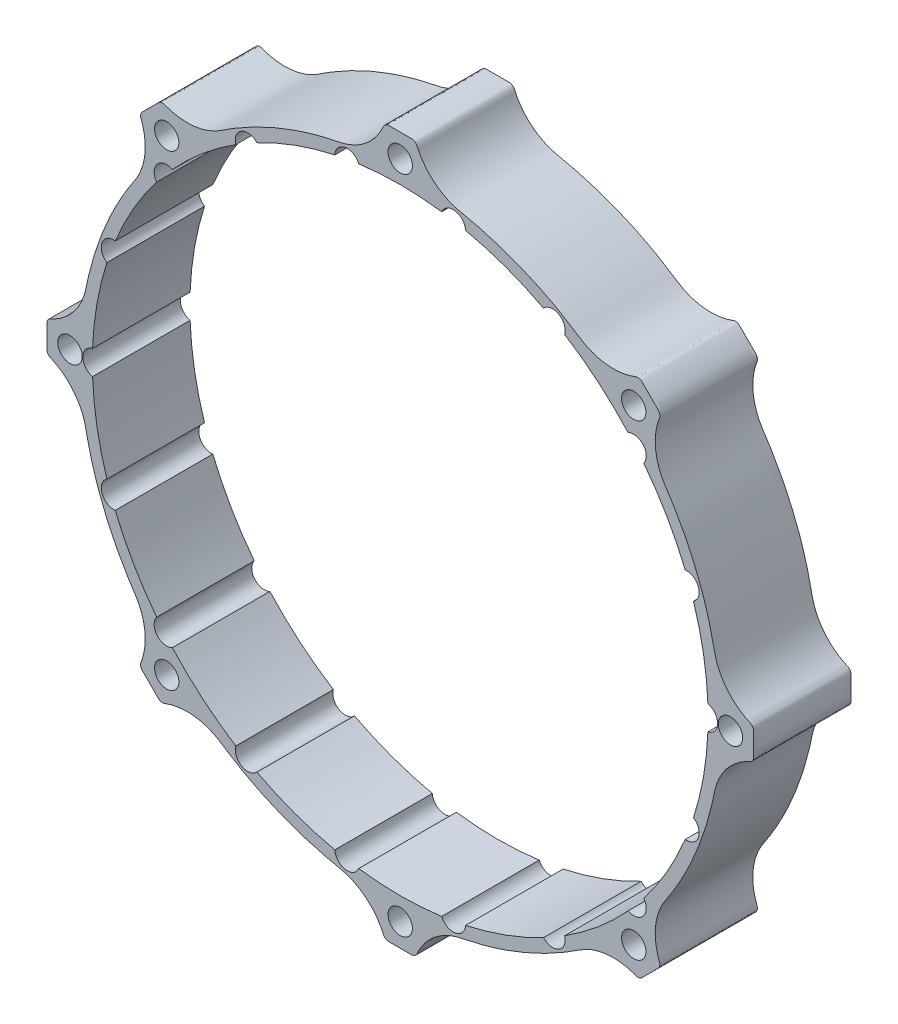
from build123d import *

# Parameters (mm, degrees)
BOSS_EXTRUDE1_DEPTH             = 16
F_4_0MM_DOWEL_HOLE1_D           = 4
F_4_0MM_DOWEL_HOLE1_CSINK_D     = 4.05
F_4_0MM_DOWEL_HOLE1_CSINK_ANGLE = 90
CIRPATTERN1_COUNT               = 8


with BuildPart() as part:
    # Sketch1 → Boss-Extrude1 (new body)
    with BuildSketch(Plane.XY):
        with BuildLine():
            add(Edge.make_bspline(
                [(2.895249818, 57.070593275), (2.866328079, 57.131672052), (2.809722916, 57.254415967), (2.730314338, 57.444073844), (2.653418588, 57.556069844), (2.609742987, 57.607640434), (2.483296792, 57.756943586), (2.319504695, 57.863958634), (2.131986062, 57.91978724), (2.101278346, 57.928929633), (2.038984153, 57.944262814), (1.942760285, 57.961362401), (1.878680735, 57.961362401), (1.84664096, 57.961362401), (1.814601185, 57.961362401), (1.750521635, 57.961362401), (1.654402311, 57.961362401), (1.590322761, 57.961362401), (1.558282986, 57.961362401), (0.519427662, 57.961362401), (-0.519427662, 57.961362401), (-1.558282986, 57.961362401), (-1.590322761, 57.961362401), (-1.654402311, 57.961362401), (-1.750521635, 57.961362401), (-1.814601185, 57.961362401), (-1.84664096, 57.961362401), (-1.878680735, 57.961362401), (-1.942760285, 57.961362401), (-2.038984153, 57.944262814), (-2.101278346, 57.928929633), (-2.131986062, 57.91978724), (-2.319504695, 57.863958634), (-2.483296792, 57.756943586), (-2.609742987, 57.607640434), (-2.653418588, 57.556069844), (-2.730314338, 57.444073844), (-2.809722916, 57.254415967), (-2.866328079, 57.131672052), (-2.895249818, 57.070593275), (-3.907352197, 54.933170755), (-5.586945631, 53.268270712), (-7.733178428, 52.274987752), (-8.218210626, 52.050513399), (-9.224266632, 51.679333443), (-10.81473369, 51.382377685), (-11.857368808, 51.146245707), (-12.376762361, 51.020248465), (-17.660128133, 49.738581586), (-22.682891966, 47.658084686), (-27.325071073, 44.828456262), (-27.781431281, 44.550283063), (-28.685656165, 43.979999224), (-30.020265638, 43.065348612), (-30.994118526, 42.616423452), (-31.495815419, 42.432181232), (-33.809504892, 41.582506281), (-36.274163076, 41.606308243), (-38.571011409, 42.500508575), (-38.571845248, 42.500833202), (-38.573512838, 42.50148268), (-38.57601405, 42.502457345), (-38.577681205, 42.503107942), (-38.578514782, 42.50343324), (-38.579346338, 42.50375775), (-38.581009449, 42.504406769), (-38.583504116, 42.505380297), (-38.585167228, 42.506029317), (-38.585998784, 42.506353826), (-38.590988118, 42.508300883), (-38.595977452, 42.510247941), (-38.600966787, 42.512194998), (-38.601798343, 42.512519508), (-38.603461454, 42.513168527), (-38.605956121, 42.514142055), (-38.607619233, 42.514791074), (-38.608450788, 42.515115584), (-38.60928525, 42.515441228), (-38.610954174, 42.516092515), (-38.613462374, 42.517057113), (-38.615135637, 42.517697174), (-38.615972697, 42.51801608), (-38.892469699, 42.623356827), (-39.187709119, 42.603838871), (-39.447932521, 42.463016124), (-39.476110803, 42.447767138), (-39.531001645, 42.414560688), (-39.611133429, 42.358611372), (-39.656444513, 42.313300288), (-39.679100055, 42.290644746), (-39.701755597, 42.267989204), (-39.747066681, 42.22267812), (-39.815033308, 42.154711493), (-39.860344392, 42.109400409), (-39.882999934, 42.086744867), (-40.617581578, 41.352163223), (-41.352163223, 40.617581578), (-42.086744867, 39.882999934), (-42.109400409, 39.860344392), (-42.154711493, 39.815033308), (-42.22267812, 39.747066681), (-42.267989204, 39.701755597), (-42.290644746, 39.679100055), (-42.313300288, 39.656444513), (-42.358611372, 39.611133429), (-42.414560688, 39.531001645), (-42.447767138, 39.476110803), (-42.463016124, 39.447932521), (-42.603838871, 39.187709119), (-42.623356827, 38.892469699), (-42.51801608, 38.615972697), (-42.517697174, 38.615135637), (-42.517057113, 38.613462374), (-42.516092515, 38.610954174), (-42.515441228, 38.60928525), (-42.515115584, 38.608450788), (-42.514791074, 38.607619233), (-42.514142055, 38.605956121), (-42.513168527, 38.603461454), (-42.512519508, 38.601798343), (-42.512194998, 38.600966787), (-42.510247941, 38.595977452), (-42.508300883, 38.590988118), (-42.506353826, 38.585998784), (-42.506029317, 38.585167228), (-42.505380297, 38.583504116), (-42.504406769, 38.581009449), (-42.50375775, 38.579346338), (-42.50343324, 38.578514782), (-42.503107942, 38.577681205), (-42.502457345, 38.57601405), (-42.50148268, 38.573512838), (-42.500833202, 38.571845248), (-42.500508575, 38.571011409), (-41.606308243, 36.274163076), (-41.582506281, 33.809504892), (-42.432181232, 31.495815419), (-42.616423452, 30.994118526), (-43.065348612, 30.020265638), (-43.979999224, 28.685656165), (-44.550283063, 27.781431281), (-44.828456262, 27.325071073), (-47.658084686, 22.682891966), (-49.738581586, 17.660128133), (-51.020248465, 12.376762361), (-51.146245707, 11.857368808), (-51.382377685, 10.81473369), (-51.679333443, 9.224266632), (-52.050513399, 8.218210626), (-52.274987752, 7.733178428), (-53.310202347, 5.496341992), (-55.069809391, 3.770396005), (-57.326221542, 2.778574093), (-57.327040701, 2.778214026), (-57.328679116, 2.777494111), (-57.331136932, 2.776414679), (-57.332775829, 2.775695865), (-57.333595278, 2.775336457), (-57.33441274, 2.774977922), (-57.336047663, 2.77426085), (-57.338500048, 2.773185243), (-57.340134971, 2.772468171), (-57.340952433, 2.772109635), (-57.345857202, 2.76995842), (-57.350761972, 2.767807206), (-57.355666742, 2.765655991), (-57.356484203, 2.765297455), (-57.358119126, 2.764580384), (-57.360571511, 2.763504776), (-57.362206434, 2.762787705), (-57.363023896, 2.762429169), (-57.363844214, 2.76206938), (-57.365484851, 2.761349803), (-57.367940491, 2.760258311), (-57.369576258, 2.759527727), (-57.370393649, 2.759161337), (-57.640393711, 2.638135588), (-57.835358227, 2.415568513), (-57.91978724, 2.131986062), (-57.928929633, 2.101278346), (-57.944262814, 2.038984153), (-57.961362401, 1.942760285), (-57.961362401, 1.878680735), (-57.961362401, 1.84664096), (-57.961362401, 1.814601185), (-57.961362401, 1.750521635), (-57.961362401, 1.654402311), (-57.961362401, 1.590322761), (-57.961362401, 1.558282986), (-57.961362401, 0.519427662), (-57.961362401, -0.519427662), (-57.961362401, -1.558282986), (-57.961362401, -1.590322761), (-57.961362401, -1.654402311), (-57.961362401, -1.750521635), (-57.961362401, -1.814601185), (-57.961362401, -1.84664096), (-57.961362401, -1.878680735), (-57.961362401, -1.942760285), (-57.944262814, -2.038984153), (-57.928929633, -2.101278346), (-57.91978724, -2.131986062), (-57.835358227, -2.415568513), (-57.640393711, -2.638135588), (-57.370393649, -2.759161337), (-57.369576258, -2.759527727), (-57.367940491, -2.760258311), (-57.365484851, -2.761349803), (-57.363844214, -2.76206938), (-57.363023896, -2.762429169), (-57.362206434, -2.762787705), (-57.360571511, -2.763504776), (-57.358119126, -2.764580384), (-57.356484203, -2.765297455), (-57.355666742, -2.765655991), (-57.350761972, -2.767807206), (-57.345857202, -2.76995842), (-57.340952433, -2.772109635), (-57.340134971, -2.772468171), (-57.338500048, -2.773185243), (-57.336047663, -2.77426085), (-57.33441274, -2.774977922), (-57.333595278, -2.775336457), (-57.332775829, -2.775695865), (-57.331136932, -2.776414679), (-57.328679116, -2.777494111), (-57.327040701, -2.778214026), (-57.326221542, -2.778574093), (-55.069809391, -3.770396005), (-53.310202347, -5.496341992), (-52.274987752, -7.733178428), (-52.050513399, -8.218210626), (-51.679333443, -9.224266632), (-51.382377685, -10.81473369), (-51.146245707, -11.857368808), (-51.020248465, -12.376762361), (-49.738581586, -17.660128133), (-47.658084686, -22.682891966), (-44.828456262, -27.325071073), (-44.550283063, -27.781431281), (-43.979999224, -28.685656165), (-43.065348612, -30.020265638), (-42.616423452, -30.994118526), (-42.432181232, -31.495815419), (-41.582506281, -33.809504892), (-41.606308243, -36.274163076), (-42.500508575, -38.571011409), (-42.500833202, -38.571845248), (-42.50148268, -38.573512838), (-42.502457345, -38.57601405), (-42.503107942, -38.577681205), (-42.50343324, -38.578514782), (-42.50375775, -38.579346338), (-42.504406769, -38.581009449), (-42.505380297, -38.583504116), (-42.506029317, -38.585167228), (-42.506353826, -38.585998784), (-42.508300883, -38.590988118), (-42.510247941, -38.595977452), (-42.512194998, -38.600966787), (-42.512519508, -38.601798343), (-42.513168527, -38.603461454), (-42.514142055, -38.605956121), (-42.514791074, -38.607619233), (-42.515115584, -38.608450788), (-42.515441228, -38.60928525), (-42.516092515, -38.610954174), (-42.517057113, -38.613462374), (-42.517697174, -38.615135637), (-42.51801608, -38.615972697), (-42.623356827, -38.892469699), (-42.603838871, -39.187709119), (-42.463016124, -39.447932521), (-42.447767138, -39.476110803), (-42.414560688, -39.531001645), (-42.358611372, -39.611133429), (-42.313300288, -39.656444513), (-42.290644746, -39.679100055), (-42.267989204, -39.701755597), (-42.22267812, -39.747066681), (-42.154711493, -39.815033308), (-42.109400409, -39.860344392), (-42.086744867, -39.882999934), (-41.352163223, -40.617581578), (-40.617581578, -41.352163223), (-39.882999934, -42.086744867), (-39.860344392, -42.109400409), (-39.815033308, -42.154711493), (-39.747066681, -42.22267812), (-39.701755597, -42.267989204), (-39.679100055, -42.290644746), (-39.656444513, -42.313300288), (-39.611133429, -42.358611372), (-39.531001645, -42.414560688), (-39.476110803, -42.447767138), (-39.447932521, -42.463016124), (-39.187709119, -42.603838871), (-38.892469699, -42.623356827), (-38.615972697, -42.51801608), (-38.615135637, -42.517697174), (-38.613462374, -42.517057113), (-38.610954174, -42.516092515), (-38.60928525, -42.515441228), (-38.608450788, -42.515115584), (-38.607619233, -42.514791074), (-38.605956121, -42.514142055), (-38.603461454, -42.513168527), (-38.601798343, -42.512519508), (-38.600966787, -42.512194998), (-38.595977452, -42.510247941), (-38.590988118, -42.508300883), (-38.585998784, -42.506353826), (-38.585167228, -42.506029317), (-38.583504116, -42.505380297), (-38.581009449, -42.504406769), (-38.579346338, -42.50375775), (-38.578514782, -42.50343324), (-38.577681205, -42.503107942), (-38.57601405, -42.502457345), (-38.573512838, -42.50148268), (-38.571845248, -42.500833202), (-38.571011409, -42.500508575), (-36.274163076, -41.606308243), (-33.809504892, -41.582506281), (-31.495815419, -42.432181232), (-30.994118526, -42.616423452), (-30.020265638, -43.065348612), (-28.685656165, -43.979999224), (-27.781431281, -44.550283063), (-27.325071073, -44.828456262), (-22.682891966, -47.658084686), (-17.660128133, -49.738581586), (-12.376762361, -51.020248465), (-11.857368808, -51.146245707), (-10.81473369, -51.382377685), (-9.224266632, -51.679333443), (-8.218210626, -52.050513399), (-7.733178428, -52.274987752), (-5.496341992, -53.310202347), (-3.770396005, -55.069809391), (-2.778574093, -57.326221542), (-2.778214026, -57.327040701), (-2.777494111, -57.328679116), (-2.776414679, -57.331136932), (-2.775695865, -57.332775829), (-2.775336457, -57.333595278), (-2.774977922, -57.33441274), (-2.77426085, -57.336047663), (-2.773185243, -57.338500048), (-2.772468171, -57.340134971), (-2.772109635, -57.340952433), (-2.76995842, -57.345857202), (-2.767807206, -57.350761972), (-2.765655991, -57.355666742), (-2.765297455, -57.356484203), (-2.764580384, -57.358119126), (-2.763504776, -57.360571511), (-2.762787705, -57.362206434), (-2.762429169, -57.363023896), (-2.76206938, -57.363844214), (-2.761349803, -57.365484851), (-2.760258311, -57.367940491), (-2.759527727, -57.369576258), (-2.759161337, -57.370393649), (-2.638135588, -57.640393711), (-2.415568513, -57.835358227), (-2.131986062, -57.91978724), (-2.101278346, -57.928929633), (-2.038984153, -57.944262814), (-1.942760285, -57.961362401), (-1.878680735, -57.961362401), (-1.84664096, -57.961362401), (-1.814601185, -57.961362401), (-1.750521635, -57.961362401), (-1.654402311, -57.961362401), (-1.590322761, -57.961362401), (-1.558282986, -57.961362401), (-0.519427662, -57.961362401), (0.519427662, -57.961362401), (1.558282986, -57.961362401), (1.590322761, -57.961362401), (1.654402311, -57.961362401), (1.750521635, -57.961362401), (1.814601185, -57.961362401), (1.84664096, -57.961362401), (1.878680735, -57.961362401), (1.942760285, -57.961362401), (2.038984153, -57.944262814), (2.101278346, -57.928929633), (2.131986062, -57.91978724), (2.415568513, -57.835358227), (2.638135588, -57.640393711), (2.759161337, -57.370393649), (2.759527727, -57.369576258), (2.760258311, -57.367940491), (2.761349803, -57.365484851), (2.76206938, -57.363844214), (2.762429169, -57.363023896), (2.762787705, -57.362206434), (2.763504776, -57.360571511), (2.764580384, -57.358119126), (2.765297455, -57.356484203), (2.765655991, -57.355666742), (2.767807206, -57.350761972), (2.76995842, -57.345857202), (2.772109635, -57.340952433), (2.772468171, -57.340134971), (2.773185243, -57.338500048), (2.77426085, -57.336047663), (2.774977922, -57.33441274), (2.775336457, -57.333595278), (2.775695865, -57.332775829), (2.776414679, -57.331136932), (2.777494111, -57.328679116), (2.778214026, -57.327040701), (2.778574093, -57.326221542), (3.770396005, -55.069809391), (5.496341992, -53.310202347), (7.733178428, -52.274987752), (8.218210626, -52.050513399), (9.224266632, -51.679333443), (10.81473369, -51.382377685), (11.857368808, -51.146245707), (12.376762361, -51.020248465), (17.660128133, -49.738581586), (22.682891966, -47.658084686), (27.325071073, -44.828456262), (27.781431281, -44.550283063), (28.685656165, -43.979999224), (30.020265638, -43.065348612), (30.994118526, -42.616423452), (31.495815419, -42.432181232), (33.809504892, -41.582506281), (36.274163076, -41.606308243), (38.571011409, -42.500508575), (38.571845248, -42.500833202), (38.573512838, -42.50148268), (38.57601405, -42.502457345), (38.577681205, -42.503107942), (38.578514782, -42.50343324), (38.579346338, -42.50375775), (38.581009449, -42.504406769), (38.583504116, -42.505380297), (38.585167228, -42.506029317), (38.585998784, -42.506353826), (38.590988118, -42.508300883), (38.595977452, -42.510247941), (38.600966787, -42.512194998), (38.601798343, -42.512519508), (38.603461454, -42.513168527), (38.605956121, -42.514142055), (38.607619233, -42.514791074), (38.608450788, -42.515115584), (38.60928525, -42.515441228), (38.610954174, -42.516092515), (38.613462374, -42.517057113), (38.615135637, -42.517697174), (38.615972697, -42.51801608), (38.892469699, -42.623356827), (39.187709119, -42.603838871), (39.447932521, -42.463016124), (39.476110803, -42.447767138), (39.531001645, -42.414560688), (39.611133429, -42.358611372), (39.656444513, -42.313300288), (39.679100055, -42.290644746), (39.701755597, -42.267989204), (39.747066681, -42.22267812), (39.815033308, -42.154711493), (39.860344392, -42.109400409), (39.882999934, -42.086744867), (40.617581578, -41.352163223), (41.352163223, -40.617581578), (42.086744867, -39.882999934), (42.109400409, -39.860344392), (42.154711493, -39.815033308), (42.22267812, -39.747066681), (42.267989204, -39.701755597), (42.290644746, -39.679100055), (42.313300288, -39.656444513), (42.358611372, -39.611133429), (42.414560688, -39.531001645), (42.447767138, -39.476110803), (42.463016124, -39.447932521), (42.603838871, -39.187709119), (42.623356827, -38.892469699), (42.51801608, -38.615972697), (42.517697174, -38.615135637), (42.517057113, -38.613462374), (42.516092515, -38.610954174), (42.515441228, -38.60928525), (42.515115584, -38.608450788), (42.514791074, -38.607619233), (42.514142055, -38.605956121), (42.513168527, -38.603461454), (42.512519508, -38.601798343), (42.512194998, -38.600966787), (42.510247941, -38.595977452), (42.508300883, -38.590988118), (42.506353826, -38.585998784), (42.506029317, -38.585167228), (42.505380297, -38.583504116), (42.504406769, -38.581009449), (42.50375775, -38.579346338), (42.50343324, -38.578514782), (42.503107942, -38.577681205), (42.502457345, -38.57601405), (42.50148268, -38.573512838), (42.500833202, -38.571845248), (42.500508575, -38.571011409), (41.606308243, -36.274163076), (41.582506281, -33.809504892), (42.432181232, -31.495815419), (42.616423452, -30.994118526), (43.065348612, -30.020265638), (43.979999224, -28.685656165), (44.550283063, -27.781431281), (44.828456262, -27.325071073), (47.658084686, -22.682891966), (49.738581586, -17.660128133), (51.020248465, -12.376762361), (51.146245707, -11.857368808), (51.382377685, -10.81473369), (51.679333443, -9.224266632), (52.050513399, -8.218210626), (52.274987752, -7.733178428), (53.310202347, -5.496341992), (55.069809391, -3.770396005), (57.326221542, -2.778574093), (57.327040701, -2.778214026), (57.328679116, -2.777494111), (57.331136932, -2.776414679), (57.332775829, -2.775695865), (57.333595278, -2.775336457), (57.33441274, -2.774977922), (57.336047663, -2.77426085), (57.338500048, -2.773185243), (57.340134971, -2.772468171), (57.340952433, -2.772109635), (57.345857202, -2.76995842), (57.350761972, -2.767807206), (57.355666742, -2.765655991), (57.356484203, -2.765297455), (57.358119126, -2.764580384), (57.360571511, -2.763504776), (57.362206434, -2.762787705), (57.363023896, -2.762429169), (57.363844214, -2.76206938), (57.365484851, -2.761349803), (57.367940491, -2.760258311), (57.369576258, -2.759527727), (57.370393649, -2.759161337), (57.640393711, -2.638135588), (57.835358227, -2.415568513), (57.91978724, -2.131986062), (57.928929633, -2.101278346), (57.944262814, -2.038984153), (57.961362401, -1.942760285), (57.961362401, -1.878680735), (57.961362401, -1.84664096), (57.961362401, -1.814601185), (57.961362401, -1.750521635), (57.961362401, -1.654402311), (57.961362401, -1.590322761), (57.961362401, -1.558282986), (57.961362401, -0.519427662), (57.961362401, 0.519427662), (57.961362401, 1.558282986), (57.961362401, 1.590322761), (57.961362401, 1.654402311), (57.961362401, 1.750521635), (57.961362401, 1.814601185), (57.961362401, 1.84664096), (57.961362401, 1.878680735), (57.961362401, 1.942760285), (57.944262814, 2.038984153), (57.928929633, 2.101278346), (57.91978724, 2.131986062), (57.835358227, 2.415568513), (57.640393711, 2.638135588), (57.370393649, 2.759161337), (57.369576258, 2.759527727), (57.367940491, 2.760258311), (57.365484851, 2.761349803), (57.363844214, 2.76206938), (57.363023896, 2.762429169), (57.362206434, 2.762787705), (57.360571511, 2.763504776), (57.358119126, 2.764580384), (57.356484203, 2.765297455), (57.355666742, 2.765655991), (57.350761972, 2.767807206), (57.345857202, 2.76995842), (57.340952433, 2.772109635), (57.340134971, 2.772468171), (57.338500048, 2.773185243), (57.336047663, 2.77426085), (57.33441274, 2.774977922), (57.333595278, 2.775336457), (57.332775829, 2.775695865), (57.331136932, 2.776414679), (57.328679116, 2.777494111), (57.327040701, 2.778214026), (57.326221542, 2.778574093), (55.069809391, 3.770396005), (53.310202347, 5.496341992), (52.274987752, 7.733178428), (52.050513399, 8.218210626), (51.679333443, 9.224266632), (51.382377685, 10.81473369), (51.146245707, 11.857368808), (51.020248465, 12.376762361), (49.738581586, 17.660128133), (47.658084686, 22.682891966), (44.828456262, 27.325071073), (44.550283063, 27.781431281), (43.979999224, 28.685656165), (43.065348612, 30.020265638), (42.616423452, 30.994118526), (42.432181232, 31.495815419), (41.582506281, 33.809504892), (41.606308243, 36.274163076), (42.500508575, 38.571011409), (42.500833202, 38.571845248), (42.50148268, 38.573512838), (42.502457345, 38.57601405), (42.503107942, 38.577681205), (42.50343324, 38.578514782), (42.50375775, 38.579346338), (42.504406769, 38.581009449), (42.505380297, 38.583504116), (42.506029317, 38.585167228), (42.506353826, 38.585998784), (42.508300883, 38.590988118), (42.510247941, 38.595977452), (42.512194998, 38.600966787), (42.512519508, 38.601798343), (42.513168527, 38.603461454), (42.514142055, 38.605956121), (42.514791074, 38.607619233), (42.515115584, 38.608450788), (42.515441228, 38.60928525), (42.516092515, 38.610954174), (42.517057113, 38.613462374), (42.517697174, 38.615135637), (42.51801608, 38.615972697), (42.623356827, 38.892469699), (42.603838871, 39.187709119), (42.463016124, 39.447932521), (42.447767138, 39.476110803), (42.414560688, 39.531001645), (42.358611372, 39.611133429), (42.313300288, 39.656444513), (42.290644746, 39.679100055), (42.267989204, 39.701755597), (42.22267812, 39.747066681), (42.154711493, 39.815033308), (42.109400409, 39.860344392), (42.086744867, 39.882999934), (41.352163223, 40.617581578), (40.617581578, 41.352163223), (39.882999934, 42.086744867), (39.860344392, 42.109400409), (39.815033308, 42.154711493), (39.747066681, 42.22267812), (39.701755597, 42.267989204), (39.679100055, 42.290644746), (39.656444513, 42.313300288), (39.611133429, 42.358611372), (39.531001645, 42.414560688), (39.476110803, 42.447767138), (39.447932521, 42.463016124), (39.187709119, 42.603838871), (38.892469699, 42.623356827), (38.615972697, 42.51801608), (38.615135637, 42.517697174), (38.613462374, 42.517057113), (38.610954174, 42.516092515), (38.60928525, 42.515441228), (38.608450788, 42.515115584), (38.607619233, 42.514791074), (38.605956121, 42.514142055), (38.603461454, 42.513168527), (38.601798343, 42.512519508), (38.600966787, 42.512194998), (38.595977452, 42.510247941), (38.590988118, 42.508300883), (38.585998784, 42.506353826), (38.585167228, 42.506029317), (38.583504116, 42.505380297), (38.581009449, 42.504406769), (38.579346338, 42.50375775), (38.578514782, 42.50343324), (38.577681205, 42.503107942), (38.57601405, 42.502457345), (38.573512838, 42.50148268), (38.571845248, 42.500833202), (38.571011409, 42.500508575), (36.274163076, 41.606308243), (33.809504892, 41.582506281), (31.495815419, 42.432181232), (30.994118526, 42.616423452), (30.020265638, 43.065348612), (28.685656165, 43.979999224), (27.781431281, 44.550283063), (27.325071073, 44.828456262), (22.682891966, 47.658084686), (17.660128133, 49.738581586), (12.376762361, 51.020248465), (11.857368808, 51.146245707), (10.81473369, 51.382377685), (9.224266632, 51.679333443), (8.218210626, 52.050513399), (7.733178428, 52.274987752), (5.586945631, 53.268270712), (3.907352197, 54.933170755), (2.895249818, 57.070593275)],
                knots=[0, 0, 0, 0, 0.000551002, 0.001102004, 0.001653006, 0.001653006, 0.001653006, 0.00320401, 0.00320401, 0.00320401, 0.00346524, 0.00372647, 0.003987701, 0.003987701, 0.003987701, 0.004248931, 0.004510161, 0.004771391, 0.004771391, 0.004771391, 0.013241496, 0.013241496, 0.013241496, 0.013502726, 0.013763957, 0.014025187, 0.014025187, 0.014025187, 0.014286417, 0.014547647, 0.014808877, 0.014808877, 0.014808877, 0.016359881, 0.016359881, 0.016359881, 0.016910883, 0.017461885, 0.018012887, 0.018012887, 0.018012887, 0.036526336, 0.036526336, 0.036526336, 0.040883933, 0.04524153, 0.049599126, 0.049599126, 0.049599126, 0.093572441, 0.093572441, 0.093572441, 0.097930038, 0.102287635, 0.106645232, 0.106645232, 0.106645232, 0.125874875, 0.125874875, 0.125874875, 0.12588217, 0.125889466, 0.125896762, 0.125896762, 0.125896762, 0.125904039, 0.125911317, 0.125918595, 0.125918595, 0.125918595, 0.125962263, 0.125962263, 0.125962263, 0.125969541, 0.125976818, 0.125984096, 0.125984096, 0.125984096, 0.1259914, 0.125998703, 0.126006006, 0.126006006, 0.126006006, 0.128272016, 0.128272016, 0.128272016, 0.128533246, 0.128794476, 0.129055707, 0.129055707, 0.129055707, 0.129316937, 0.129578167, 0.129839397, 0.129839397, 0.129839397, 0.138309502, 0.138309502, 0.138309502, 0.138570732, 0.138831963, 0.139093193, 0.139093193, 0.139093193, 0.139354423, 0.139615653, 0.139876883, 0.139876883, 0.139876883, 0.142142893, 0.142142893, 0.142142893, 0.142150196, 0.142157499, 0.142164803, 0.142164803, 0.142164803, 0.142172081, 0.142179359, 0.142186636, 0.142186636, 0.142186636, 0.142230304, 0.142230304, 0.142230304, 0.142237582, 0.14224486, 0.142252138, 0.142252138, 0.142252138, 0.142259433, 0.142266729, 0.142274024, 0.142274024, 0.142274024, 0.161503667, 0.161503667, 0.161503667, 0.165861264, 0.170218861, 0.174576458, 0.174576458, 0.174576458, 0.218549773, 0.218549773, 0.218549773, 0.22290737, 0.227264966, 0.231622563, 0.231622563, 0.231622563, 0.250852206, 0.250852206, 0.250852206, 0.250859502, 0.250866797, 0.250874093, 0.250874093, 0.250874093, 0.250881371, 0.250888649, 0.250895927, 0.250895927, 0.250895927, 0.250939594, 0.250939594, 0.250939594, 0.250946872, 0.25095415, 0.250961428, 0.250961428, 0.250961428, 0.250968731, 0.250976034, 0.250983338, 0.250983338, 0.250983338, 0.253249348, 0.253249348, 0.253249348, 0.253510578, 0.253771808, 0.254033038, 0.254033038, 0.254033038, 0.254294268, 0.254555498, 0.254816728, 0.254816728, 0.254816728, 0.263286834, 0.263286834, 0.263286834, 0.263548064, 0.263809294, 0.264070524, 0.264070524, 0.264070524, 0.264331754, 0.264592984, 0.264854214, 0.264854214, 0.264854214, 0.267120224, 0.267120224, 0.267120224, 0.267127527, 0.267134831, 0.267142134, 0.267142134, 0.267142134, 0.267149412, 0.26715669, 0.267163968, 0.267163968, 0.267163968, 0.267207635, 0.267207635, 0.267207635, 0.267214913, 0.267222191, 0.267229469, 0.267229469, 0.267229469, 0.267236765, 0.26724406, 0.267251356, 0.267251356, 0.267251356, 0.286480999, 0.286480999, 0.286480999, 0.290838595, 0.295196192, 0.299553789, 0.299553789, 0.299553789, 0.343527104, 0.343527104, 0.343527104, 0.347884701, 0.352242298, 0.356599894, 0.356599894, 0.356599894, 0.375829537, 0.375829537, 0.375829537, 0.375836833, 0.375844129, 0.375851424, 0.375851424, 0.375851424, 0.375858702, 0.37586598, 0.375873258, 0.375873258, 0.375873258, 0.375916925, 0.375916925, 0.375916925, 0.375924203, 0.375931481, 0.375938759, 0.375938759, 0.375938759, 0.375946062, 0.375953366, 0.375960669, 0.375960669, 0.375960669, 0.378226679, 0.378226679, 0.378226679, 0.378487909, 0.378749139, 0.379010369, 0.379010369, 0.379010369, 0.379271599, 0.379532829, 0.379794059, 0.379794059, 0.379794059, 0.388264165, 0.388264165, 0.388264165, 0.388525395, 0.388786625, 0.389047855, 0.389047855, 0.389047855, 0.389309085, 0.389570315, 0.389831546, 0.389831546, 0.389831546, 0.392097555, 0.392097555, 0.392097555, 0.392104859, 0.392112162, 0.392119465, 0.392119465, 0.392119465, 0.392126743, 0.392134021, 0.392141299, 0.392141299, 0.392141299, 0.392184967, 0.392184967, 0.392184967, 0.392192244, 0.392199522, 0.3922068, 0.3922068, 0.3922068, 0.392214096, 0.392221391, 0.392228687, 0.392228687, 0.392228687, 0.41145833, 0.41145833, 0.41145833, 0.415815927, 0.420173524, 0.42453112, 0.42453112, 0.42453112, 0.468504436, 0.468504436, 0.468504436, 0.472862032, 0.477219629, 0.481577226, 0.481577226, 0.481577226, 0.500806869, 0.500806869, 0.500806869, 0.500814164, 0.50082146, 0.500828756, 0.500828756, 0.500828756, 0.500836033, 0.500843311, 0.500850589, 0.500850589, 0.500850589, 0.500894257, 0.500894257, 0.500894257, 0.500901535, 0.500908812, 0.50091609, 0.50091609, 0.50091609, 0.500923394, 0.500930697, 0.500938, 0.500938, 0.500938, 0.50320401, 0.50320401, 0.50320401, 0.50346524, 0.50372647, 0.503987701, 0.503987701, 0.503987701, 0.504248931, 0.504510161, 0.504771391, 0.504771391, 0.504771391, 0.513241496, 0.513241496, 0.513241496, 0.513502726, 0.513763957, 0.514025187, 0.514025187, 0.514025187, 0.514286417, 0.514547647, 0.514808877, 0.514808877, 0.514808877, 0.517074887, 0.517074887, 0.517074887, 0.51708219, 0.517089493, 0.517096797, 0.517096797, 0.517096797, 0.517104075, 0.517111353, 0.51711863, 0.51711863, 0.51711863, 0.517162298, 0.517162298, 0.517162298, 0.517169576, 0.517176854, 0.517184132, 0.517184132, 0.517184132, 0.517191427, 0.517198723, 0.517206018, 0.517206018, 0.517206018, 0.536435661, 0.536435661, 0.536435661, 0.540793258, 0.545150855, 0.549508452, 0.549508452, 0.549508452, 0.593481767, 0.593481767, 0.593481767, 0.597839364, 0.60219696, 0.606554557, 0.606554557, 0.606554557, 0.6257842, 0.6257842, 0.6257842, 0.625791496, 0.625798791, 0.625806087, 0.625806087, 0.625806087, 0.625813365, 0.625820643, 0.625827921, 0.625827921, 0.625827921, 0.625871588, 0.625871588, 0.625871588, 0.625878866, 0.625886144, 0.625893422, 0.625893422, 0.625893422, 0.625900725, 0.625908028, 0.625915332, 0.625915332, 0.625915332, 0.628181342, 0.628181342, 0.628181342, 0.628442572, 0.628703802, 0.628965032, 0.628965032, 0.628965032, 0.629226262, 0.629487492, 0.629748722, 0.629748722, 0.629748722, 0.638218828, 0.638218828, 0.638218828, 0.638480058, 0.638741288, 0.639002518, 0.639002518, 0.639002518, 0.639263748, 0.639524978, 0.639786208, 0.639786208, 0.639786208, 0.642052218, 0.642052218, 0.642052218, 0.642059521, 0.642066825, 0.642074128, 0.642074128, 0.642074128, 0.642081406, 0.642088684, 0.642095962, 0.642095962, 0.642095962, 0.642139629, 0.642139629, 0.642139629, 0.642146907, 0.642154185, 0.642161463, 0.642161463, 0.642161463, 0.642168759, 0.642176054, 0.64218335, 0.64218335, 0.64218335, 0.661412993, 0.661412993, 0.661412993, 0.665770589, 0.670128186, 0.674485783, 0.674485783, 0.674485783, 0.718459098, 0.718459098, 0.718459098, 0.722816695, 0.727174292, 0.731531888, 0.731531888, 0.731531888, 0.750761531, 0.750761531, 0.750761531, 0.750768827, 0.750776123, 0.750783418, 0.750783418, 0.750783418, 0.750790696, 0.750797974, 0.750805252, 0.750805252, 0.750805252, 0.750848919, 0.750848919, 0.750848919, 0.750856197, 0.750863475, 0.750870753, 0.750870753, 0.750870753, 0.750878056, 0.75088536, 0.750892663, 0.750892663, 0.750892663, 0.753158673, 0.753158673, 0.753158673, 0.753419903, 0.753681133, 0.753942363, 0.753942363, 0.753942363, 0.754203593, 0.754464823, 0.754726054, 0.754726054, 0.754726054, 0.763196159, 0.763196159, 0.763196159, 0.763457389, 0.763718619, 0.763979849, 0.763979849, 0.763979849, 0.764241079, 0.76450231, 0.76476354, 0.76476354, 0.76476354, 0.767029549, 0.767029549, 0.767029549, 0.767036853, 0.767044156, 0.767051459, 0.767051459, 0.767051459, 0.767058737, 0.767066015, 0.767073293, 0.767073293, 0.767073293, 0.767116961, 0.767116961, 0.767116961, 0.767124238, 0.767131516, 0.767138794, 0.767138794, 0.767138794, 0.76714609, 0.767153385, 0.767160681, 0.767160681, 0.767160681, 0.786390324, 0.786390324, 0.786390324, 0.790747921, 0.795105518, 0.799463114, 0.799463114, 0.799463114, 0.84343643, 0.84343643, 0.84343643, 0.847794026, 0.852151623, 0.85650922, 0.85650922, 0.85650922, 0.875738863, 0.875738863, 0.875738863, 0.875746158, 0.875753454, 0.87576075, 0.87576075, 0.87576075, 0.875768028, 0.875775305, 0.875782583, 0.875782583, 0.875782583, 0.875826251, 0.875826251, 0.875826251, 0.875833529, 0.875840807, 0.875848084, 0.875848084, 0.875848084, 0.875855388, 0.875862691, 0.875869994, 0.875869994, 0.875869994, 0.878136004, 0.878136004, 0.878136004, 0.878397234, 0.878658464, 0.878919695, 0.878919695, 0.878919695, 0.879180925, 0.879442155, 0.879703385, 0.879703385, 0.879703385, 0.88817349, 0.88817349, 0.88817349, 0.88843472, 0.888695951, 0.888957181, 0.888957181, 0.888957181, 0.889218411, 0.889479641, 0.889740871, 0.889740871, 0.889740871, 0.892006881, 0.892006881, 0.892006881, 0.892014184, 0.892021488, 0.892028791, 0.892028791, 0.892028791, 0.892036069, 0.892043347, 0.892050625, 0.892050625, 0.892050625, 0.892094292, 0.892094292, 0.892094292, 0.89210157, 0.892108848, 0.892116126, 0.892116126, 0.892116126, 0.892123421, 0.892130717, 0.892138012, 0.892138012, 0.892138012, 0.911367655, 0.911367655, 0.911367655, 0.915725252, 0.920082849, 0.924440446, 0.924440446, 0.924440446, 0.968413761, 0.968413761, 0.968413761, 0.972771358, 0.977128954, 0.981486551, 0.981486551, 0.981486551, 1, 1, 1, 1], degree=3, weights=[1, 1, 1, 1, 1, 1, 0.972283226, 0.972283226, 1, 1, 1, 1, 1, 1, 1, 1, 1, 1, 1, 1, 1, 1, 1, 1, 1, 1, 1, 1, 1, 1, 1, 1, 0.972283226, 0.972283226, 1, 1, 1, 1, 1, 1, 0.960138827, 0.960138827, 1, 1, 1, 1, 1, 1, 0.992037399, 0.992037399, 1, 1, 1, 1, 1, 1, 0.956886711, 0.956886711, 1, 1, 1, 1, 1, 1, 1, 1, 1, 1, 1, 1, 1, 1, 1, 1, 1, 1, 1, 1, 1, 1, 1, 1, 0.939305267, 0.939305267, 1, 1, 1, 1, 1, 1, 1, 1, 1, 1, 1, 1, 1, 1, 1, 1, 1, 1, 1, 1, 1, 1, 1, 1, 0.939305267, 0.939305267, 1, 1, 1, 1, 1, 1, 1, 1, 1, 1, 1, 1, 1, 1, 1, 1, 1, 1, 1, 1, 1, 1, 1, 1, 0.956886711, 0.956886711, 1, 1, 1, 1, 1, 1, 0.992037399, 0.992037399, 1, 1, 1, 1, 1, 1, 0.956886711, 0.956886711, 1, 1, 1, 1, 1, 1, 1, 1, 1, 1, 1, 1, 1, 1, 1, 1, 1, 1, 1, 1, 1, 1, 1, 1, 0.939305267, 0.939305267, 1, 1, 1, 1, 1, 1, 1, 1, 1, 1, 1, 1, 1, 1, 1, 1, 1, 1, 1, 1, 1, 1, 1, 1, 0.939305267, 0.939305267, 1, 1, 1, 1, 1, 1, 1, 1, 1, 1, 1, 1, 1, 1, 1, 1, 1, 1, 1, 1, 1, 1, 1, 1, 0.956886711, 0.956886711, 1, 1, 1, 1, 1, 1, 0.992037399, 0.992037399, 1, 1, 1, 1, 1, 1, 0.956886711, 0.956886711, 1, 1, 1, 1, 1, 1, 1, 1, 1, 1, 1, 1, 1, 1, 1, 1, 1, 1, 1, 1, 1, 1, 1, 1, 0.939305267, 0.939305267, 1, 1, 1, 1, 1, 1, 1, 1, 1, 1, 1, 1, 1, 1, 1, 1, 1, 1, 1, 1, 1, 1, 1, 1, 0.939305267, 0.939305267, 1, 1, 1, 1, 1, 1, 1, 1, 1, 1, 1, 1, 1, 1, 1, 1, 1, 1, 1, 1, 1, 1, 1, 1, 0.956886711, 0.956886711, 1, 1, 1, 1, 1, 1, 0.992037399, 0.992037399, 1, 1, 1, 1, 1, 1, 0.956886711, 0.956886711, 1, 1, 1, 1, 1, 1, 1, 1, 1, 1, 1, 1, 1, 1, 1, 1, 1, 1, 1, 1, 1, 1, 1, 1, 0.939305267, 0.939305267, 1, 1, 1, 1, 1, 1, 1, 1, 1, 1, 1, 1, 1, 1, 1, 1, 1, 1, 1, 1, 1, 1, 1, 1, 0.939305267, 0.939305267, 1, 1, 1, 1, 1, 1, 1, 1, 1, 1, 1, 1, 1, 1, 1, 1, 1, 1, 1, 1, 1, 1, 1, 1, 0.956886711, 0.956886711, 1, 1, 1, 1, 1, 1, 0.992037399, 0.992037399, 1, 1, 1, 1, 1, 1, 0.956886711, 0.956886711, 1, 1, 1, 1, 1, 1, 1, 1, 1, 1, 1, 1, 1, 1, 1, 1, 1, 1, 1, 1, 1, 1, 1, 1, 0.939305267, 0.939305267, 1, 1, 1, 1, 1, 1, 1, 1, 1, 1, 1, 1, 1, 1, 1, 1, 1, 1, 1, 1, 1, 1, 1, 1, 0.939305267, 0.939305267, 1, 1, 1, 1, 1, 1, 1, 1, 1, 1, 1, 1, 1, 1, 1, 1, 1, 1, 1, 1, 1, 1, 1, 1, 0.956886711, 0.956886711, 1, 1, 1, 1, 1, 1, 0.992037399, 0.992037399, 1, 1, 1, 1, 1, 1, 0.956886711, 0.956886711, 1, 1, 1, 1, 1, 1, 1, 1, 1, 1, 1, 1, 1, 1, 1, 1, 1, 1, 1, 1, 1, 1, 1, 1, 0.939305267, 0.939305267, 1, 1, 1, 1, 1, 1, 1, 1, 1, 1, 1, 1, 1, 1, 1, 1, 1, 1, 1, 1, 1, 1, 1, 1, 0.939305267, 0.939305267, 1, 1, 1, 1, 1, 1, 1, 1, 1, 1, 1, 1, 1, 1, 1, 1, 1, 1, 1, 1, 1, 1, 1, 1, 0.956886711, 0.956886711, 1, 1, 1, 1, 1, 1, 0.992037399, 0.992037399, 1, 1, 1, 1, 1, 1, 0.956886711, 0.956886711, 1, 1, 1, 1, 1, 1, 1, 1, 1, 1, 1, 1, 1, 1, 1, 1, 1, 1, 1, 1, 1, 1, 1, 1, 0.939305267, 0.939305267, 1, 1, 1, 1, 1, 1, 1, 1, 1, 1, 1, 1, 1, 1, 1, 1, 1, 1, 1, 1, 1, 1, 1, 1, 0.939305267, 0.939305267, 1, 1, 1, 1, 1, 1, 1, 1, 1, 1, 1, 1, 1, 1, 1, 1, 1, 1, 1, 1, 1, 1, 1, 1, 0.956886711, 0.956886711, 1, 1, 1, 1, 1, 1, 0.992037399, 0.992037399, 1, 1, 1, 1, 1, 1, 0.960138827, 0.960138827, 1]))
        make_face()
        with BuildLine():
            ThreePointArc((-6.795103507, 50.040749078), (-9.038387648, 51.259243544), (-10.729635549, 49.346984923))
            ThreePointArc((-10.729635549, 49.346984923), (-17.272017238, 47.45447735), (-23.500252795, 44.698860372))
            ThreePointArc((-23.500252795, 44.698860372), (-26.025, 45.076622267), (-26.960222205, 42.701246102))
            ThreePointArc((-26.960222205, 42.701246102), (-32.460774289, 38.685244378), (-37.370924769, 33.96562942))
            ThreePointArc((-37.370924769, 33.96562942), (-39.872613264, 33.457095084), (-39.939008173, 30.905106797))
            ThreePointArc((-39.939008173, 30.905106797), (-43.734282891, 25.25), (-46.73411168, 19.135642281))
            ThreePointArc((-46.73411168, 19.135642281), (-48.911000912, 17.80214846), (-48.100560318, 15.381355502))
            ThreePointArc((-48.100560318, 15.381355502), (-49.732791527, 8.769232972), (-50.460475, 1.997614271))
            ThreePointArc((-50.460475, 1.997614271), (-52.05, 0), (-50.460475, -1.997614271))
            ThreePointArc((-50.460475, -1.997614271), (-49.732791527, -8.769232972), (-48.100560318, -15.381355502))
            ThreePointArc((-48.100560318, -15.381355502), (-48.911000912, -17.80214846), (-46.73411168, -19.135642281))
            ThreePointArc((-46.73411168, -19.135642281), (-43.734282891, -25.25), (-39.939008173, -30.905106797))
            ThreePointArc((-39.939008173, -30.905106797), (-39.872613264, -33.457095084), (-37.370924769, -33.96562942))
            ThreePointArc((-37.370924769, -33.96562942), (-32.460774289, -38.685244378), (-26.960222205, -42.701246102))
            ThreePointArc((-26.960222205, -42.701246102), (-26.025, -45.076622267), (-23.500252795, -44.698860372))
            ThreePointArc((-23.500252795, -44.698860372), (-17.272017238, -47.45447735), (-10.729635549, -49.346984923))
            ThreePointArc((-10.729635549, -49.346984923), (-9.038387648, -51.259243544), (-6.795103507, -50.040749078))
            ThreePointArc((-6.795103507, -50.040749078), (0, -50.5), (6.795103507, -50.040749078))
            ThreePointArc((6.795103507, -50.040749078), (9.038387648, -51.259243544), (10.729635549, -49.346984923))
            ThreePointArc((10.729635549, -49.346984923), (17.272017238, -47.45447735), (23.500252795, -44.698860372))
            ThreePointArc((23.500252795, -44.698860372), (26.025, -45.076622267), (26.960222205, -42.701246102))
            ThreePointArc((26.960222205, -42.701246102), (32.460774289, -38.685244378), (37.370924769, -33.96562942))
            ThreePointArc((37.370924769, -33.96562942), (39.872613264, -33.457095084), (39.939008173, -30.905106797))
            ThreePointArc((39.939008173, -30.905106797), (43.734282891, -25.25), (46.73411168, -19.135642281))
            ThreePointArc((46.73411168, -19.135642281), (48.911000912, -17.80214846), (48.100560318, -15.381355502))
            ThreePointArc((48.100560318, -15.381355502), (49.732791527, -8.769232972), (50.460475, -1.997614271))
            ThreePointArc((50.460475, -1.997614271), (52.05, 0), (50.460475, 1.997614271))
            ThreePointArc((50.460475, 1.997614271), (49.732791527, 8.769232972), (48.100560318, 15.381355502))
            ThreePointArc((48.100560318, 15.381355502), (48.911000912, 17.80214846), (46.73411168, 19.135642281))
            ThreePointArc((46.73411168, 19.135642281), (43.734282891, 25.25), (39.939008173, 30.905106797))
            ThreePointArc((39.939008173, 30.905106797), (39.872613264, 33.457095084), (37.370924769, 33.96562942))
            ThreePointArc((37.370924769, 33.96562942), (32.460774289, 38.685244378), (26.960222205, 42.701246102))
            ThreePointArc((26.960222205, 42.701246102), (26.025, 45.076622267), (23.500252795, 44.698860372))
            ThreePointArc((23.500252795, 44.698860372), (17.272017238, 47.45447735), (10.729635549, 49.346984923))
            ThreePointArc((10.729635549, 49.346984923), (9.038387648, 51.259243544), (6.795103507, 50.040749078))
            ThreePointArc((6.795103507, 50.040749078), (0, 50.5), (-6.795103507, 50.040749078))
        make_face(mode=Mode.SUBTRACT)
    extrude(amount=BOSS_EXTRUDE1_DEPTH)

    # Ø4.0mm Dowel Hole1 (through all)
    with Locations(Plane(origin=(0, 0, 0), x_dir=(-1, 0, 0), z_dir=(0, 0, -1))):
        with Locations((0, 54.161362401)):
            f_4_0mm_dowel_hole1 = CounterSinkHole(F_4_0MM_DOWEL_HOLE1_D / 2, F_4_0MM_DOWEL_HOLE1_CSINK_D / 2, counter_sink_angle=F_4_0MM_DOWEL_HOLE1_CSINK_ANGLE)

    # CirPattern1: Ø4.0mm Dowel Hole1 ×8 about axis
    cirpattern1_axis = Axis((0, 0, 16), (0, 0, -1))
    for i in range(1, CIRPATTERN1_COUNT):
        add(f_4_0mm_dowel_hole1.rotate(cirpattern1_axis, i * 360 / CIRPATTERN1_COUNT), mode=Mode.SUBTRACT)


solid = part.part
